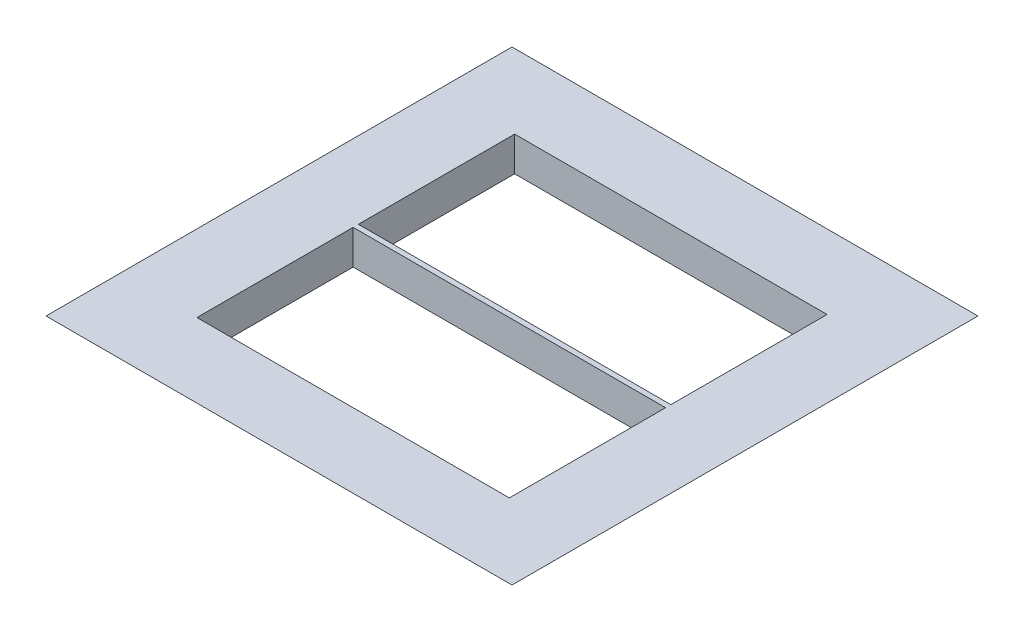
from build123d import *

# Parameters (mm, degrees)
SKETCH1_W           = 150
SKETCH1_H           = 150
BOSS_EXTRUDE1_DEPTH = 13
BOSS_EXTRUDE1_DRAFT = -45
SKETCH2_W           = 118
SKETCH2_H           = 59
CUT_EXTRUDE1_DEPTH  = 13


with BuildPart() as part:
    # Sketch1 → Boss-Extrude1 (with draft: the straight prism first)
    with BuildSketch(Plane(origin=(0, 0, 0), x_dir=(1, 0, 0), z_dir=(0, 1, 0))):
        with Locations((75, 75)):
            Rectangle(SKETCH1_W, SKETCH1_H)
    extrude(amount=BOSS_EXTRUDE1_DEPTH)
    # Boss-Extrude1: the draft: its side faces are tilted about the plane it starts from
    boss_extrude1_sides = [part.faces().sort_by_distance(p)[0] for p in [
        (75, 6.5, 0),
        (150, 6.5, -75),
        (75, 6.5, -150),
        (0, 6.5, -75),
    ]]
    draft(boss_extrude1_sides, Plane(origin=(0, 0, 0), x_dir=(1, 0, 0), z_dir=(0, 1, 0)), BOSS_EXTRUDE1_DRAFT)

    # Sketch2 → Cut-Extrude1 (cut)
    with BuildSketch(Plane(origin=(0, 13, 0), x_dir=(1, 0, 0), z_dir=(0, 1, 0))):
        with Locations((75, 44.5)):
            Rectangle(SKETCH2_W, SKETCH2_H)
        with Locations((75, 105.5)):
            Rectangle(SKETCH2_W, SKETCH2_H)
    extrude(amount=-CUT_EXTRUDE1_DEPTH, mode=Mode.SUBTRACT)


solid = part.part
